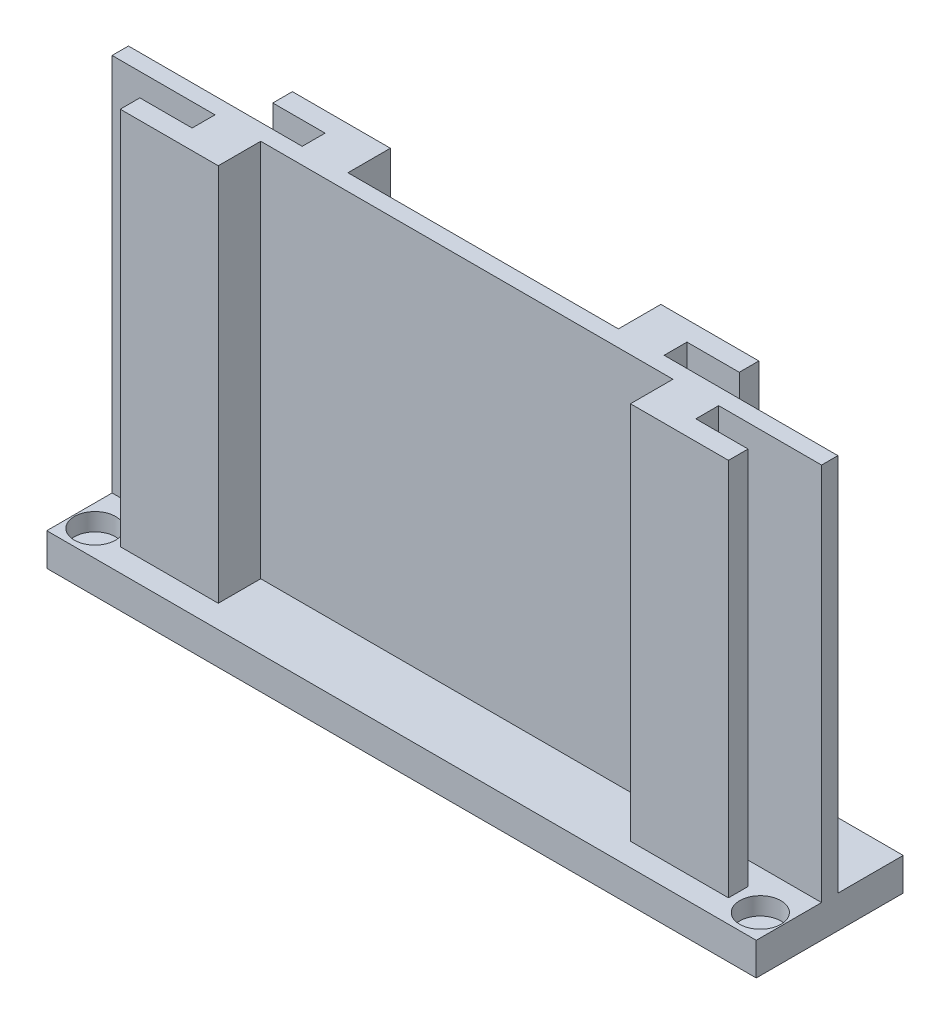
from build123d import *

# Parameters (mm, degrees)
SKETCH1_W           = 108.6
SKETCH1_H           = 22.5
BOSS_EXTRUDE1_DEPTH = 5
SKETCH2_R           = 3.15
CUT_EXTRUDE1_DEPTH  = 2.7
BOSS_EXTRUDE2_DEPTH = 58


with BuildPart() as part:
    # Sketch1 → Boss-Extrude1 (new body)
    with BuildSketch(Plane(origin=(0, 0, 0), x_dir=(1, 0, 0), z_dir=(0, 1, 0))):
        Rectangle(SKETCH1_W, SKETCH1_H)
    extrude(amount=BOSS_EXTRUDE1_DEPTH)

    # Sketch2 → Cut-Extrude1 (cut)
    with BuildSketch(Plane(origin=(0, 5, 0), x_dir=(1, 0, 0), z_dir=(0, 1, 0))):
        with Locations((50.925, -7.25)):
            Circle(SKETCH2_R)
        with Locations((40.075, 7.25)):
            Circle(SKETCH2_R)
        with Locations((-50.925, -7.25)):
            Circle(SKETCH2_R)
        with Locations((-40.075, 7.25)):
            Circle(SKETCH2_R)
    extrude(amount=-CUT_EXTRUDE1_DEPTH, mode=Mode.SUBTRACT)

    # Sketch3 → Boss-Extrude2 (add)
    with BuildSketch(Plane(origin=(0, 5, 0), x_dir=(1, 0, 0), z_dir=(0, 1, 0))):
        Polygon((-54.3, 1.25), (-54.3, -1.25), (-38.55, -1.25), (-38.55, -4.75), (-46.55, -4.75), (-46.55, -7.75), (-31.55, -7.75), (-31.55, -1.25), (54.3, -1.25), (54.3, 1.25), (-20.7, 1.25), (-20.7, 7.75), (-35.7, 7.75), (-35.7, 4.75), (-27.7, 4.75), (-27.7, 1.25), align=None)
    boss_extrude2 = extrude(amount=BOSS_EXTRUDE2_DEPTH)

    # Mirror1: Boss-Extrude2 across plane
    add(boss_extrude2.mirror(Plane(origin=(0, 0, 0), x_dir=(0, 0, 1), z_dir=(1, 0, 0))))


solid = part.part
